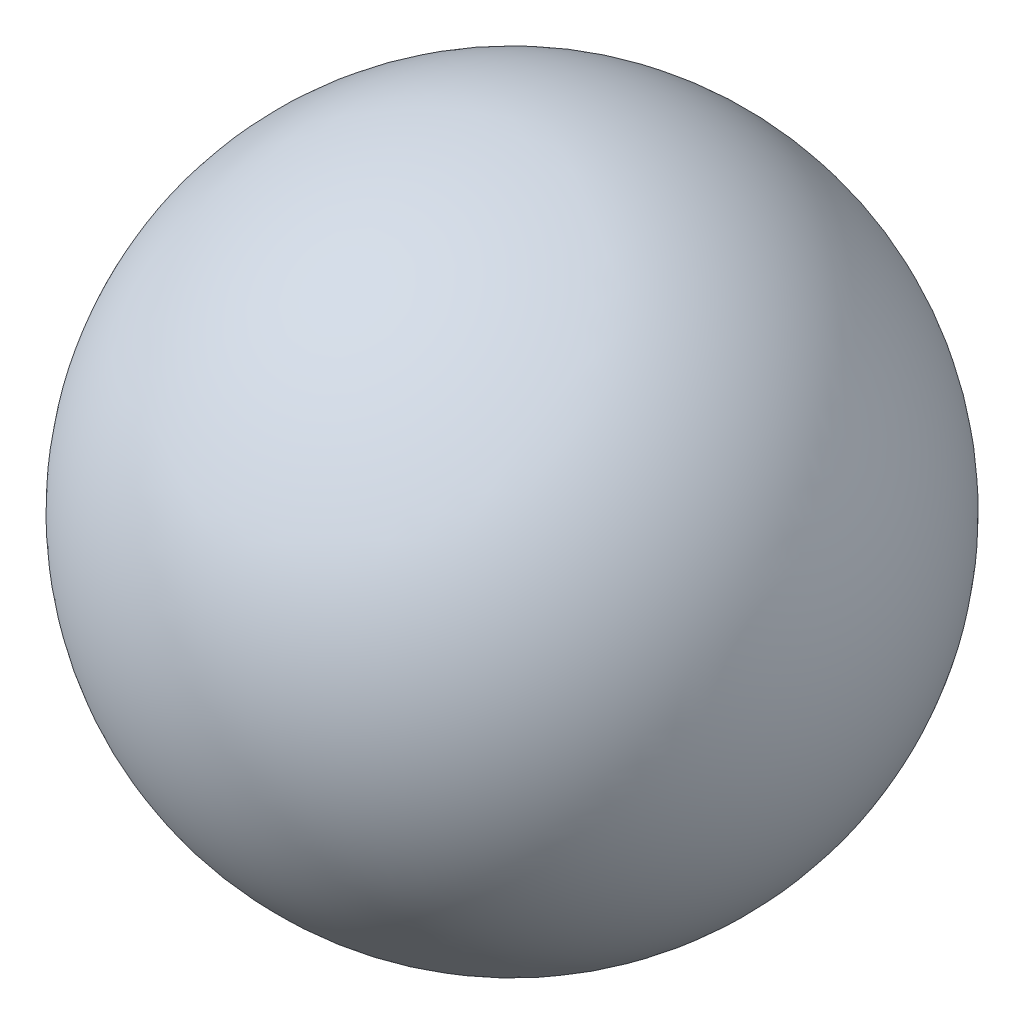
from build123d import *


with BuildPart() as part:
    # Sketch2 → Revolve1 (revolve)
    with BuildSketch(Plane.XY):
        with BuildLine():
            Line((904.53288994, 0), (-904.53288994, 0))
            ThreePointArc((-904.53288994, 0), (0, 904.53288994), (904.53288994, 0))
        make_face()
    revolve(axis=Axis((904.53288994, 0, 0), (-1, 0, 0)))


solid = part.part
